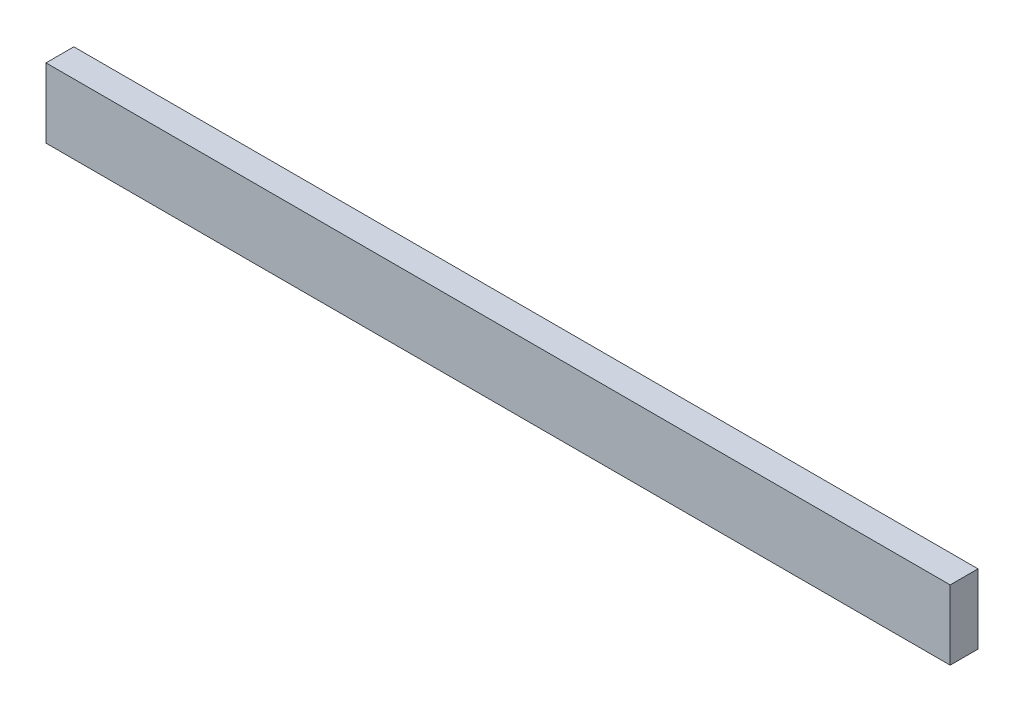
from build123d import *

# Parameters (mm, degrees)
ESBO_O1_W                = 130
ESBO_O1_H                = 10
RESSALTO_EXTRUS_O2_DEPTH = 4


with BuildPart() as part:
    # Esboço1 → Ressalto-extrusão2 (new body)
    with BuildSketch(Plane.XY):
        with Locations((-7.107871181, -5)):
            Rectangle(ESBO_O1_W, ESBO_O1_H)
    extrude(amount=RESSALTO_EXTRUS_O2_DEPTH)


solid = part.part
